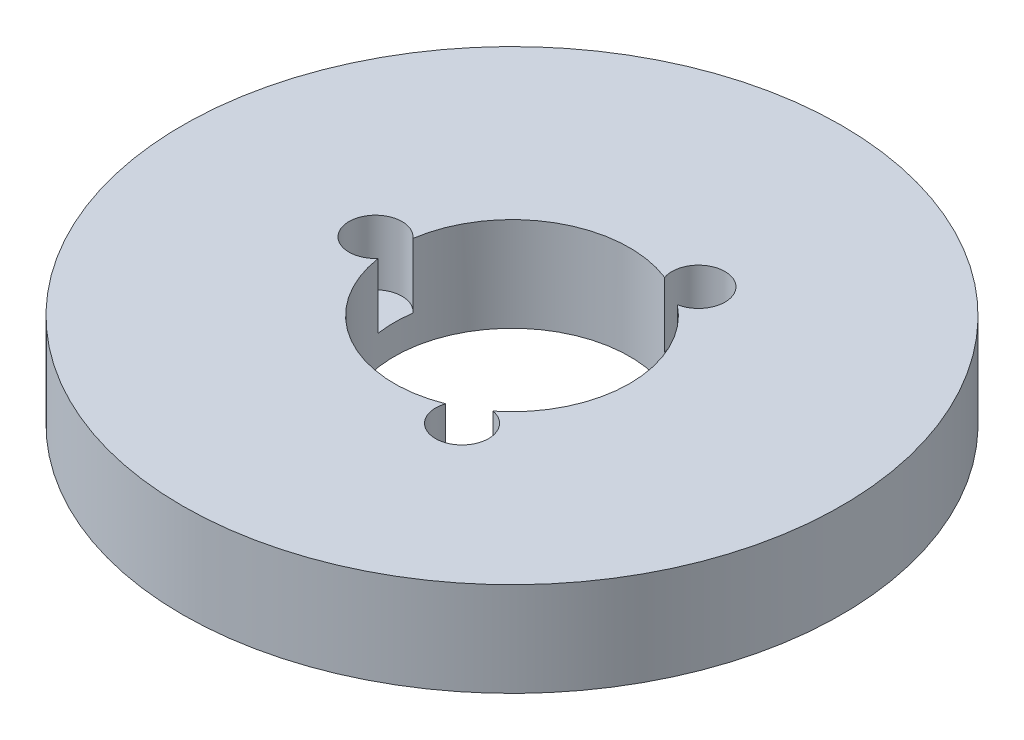
from build123d import *

# Parameters (mm, degrees)
SKETCH1_R           = 35
BOSS_EXTRUDE1_DEPTH = 10
SKETCH2_R           = 12.5
CUT_EXTRUDE1_DEPTH  = 51.497524692
SKETCH3_R           = 2.819325065
CUT_EXTRUDE2_DEPTH  = 6.870913211
CIRPATTERN1_COUNT   = 3


with BuildPart() as part:
    # Sketch1 → Boss-Extrude1 (new body)
    with BuildSketch(Plane(origin=(0, 0, 0), x_dir=(1, 0, 0), z_dir=(0, 1, 0))):
        Circle(SKETCH1_R)
    extrude(amount=BOSS_EXTRUDE1_DEPTH)

    # Sketch2 → Cut-Extrude1 (cut, through all)
    with BuildSketch(Plane(origin=(0, 0, 0), x_dir=(1, 0, 0), z_dir=(0, 1, 0))):
        Circle(SKETCH2_R)
    extrude(amount=CUT_EXTRUDE1_DEPTH, mode=Mode.SUBTRACT)

    # Sketch3 → Cut-Extrude2 (cut)
    with BuildSketch(Plane(origin=(0, 10, 0), x_dir=(1, 0, 0), z_dir=(0, 1, 0))):
        with Locations((-14.497821503, 0)):
            Circle(SKETCH3_R)
    cut_extrude2 = extrude(amount=-CUT_EXTRUDE2_DEPTH, mode=Mode.SUBTRACT)

    # CirPattern1: Cut-Extrude2 ×3 about axis
    cirpattern1_axis = Axis((0, 0, 0), (0, 1, 0))
    for i in range(1, CIRPATTERN1_COUNT):
        add(cut_extrude2.rotate(cirpattern1_axis, i * 360 / CIRPATTERN1_COUNT), mode=Mode.SUBTRACT)


solid = part.part
